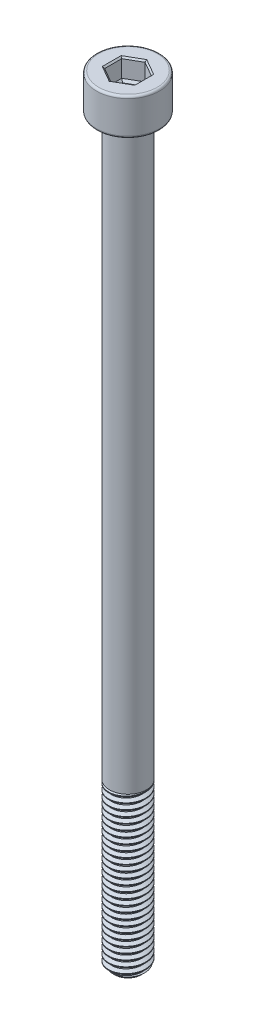
from build123d import *

# Parameters (mm, degrees)
SKETCH1_R           = 2.5
BOSS_EXTRUDE1_DEPTH = 22
THREAD1_PITCH       = 0.8
SKETCH2_R           = 2.5
BOSS_EXTRUDE2_DEPTH = 78
SKETCH3_R           = 4.25
BOSS_EXTRUDE3_DEPTH = 5
FILLET1_R           = 0.3
CUT_EXTRUDE1_DEPTH  = 2.5
CHAMFER1_SIZE       = 0.2
CUT_EXTRUDE2_DEPTH  = 0.3
CUT_EXTRUDE2_DRAFT  = -45


with BuildPart() as part:
    # Sketch1 → Boss-Extrude1 (new body)
    with BuildSketch(Plane(origin=(0, 0, 0), x_dir=(1, 0, 0), z_dir=(0, 1, 0))):
        with Locations(Location((0, 0, 0), (0, 0, 270))):
            Circle(SKETCH1_R)
    extrude(amount=BOSS_EXTRUDE1_DEPTH)

    # Thread1: arcs per turn and ends read off the stored shape
    # Thread1: the profile of Thread Profile1 profile screwed along a right-hand helix through 30 turns, 8 arcs to a turn; built about Z, then put on its axis
    thread1_z = Axis((0, 0, 0), (0, 0, 1))
    thread1_corners = [(2.5003, 0, -0.000173205), (2.5003, 0, 0.700173203), (2.0669873, 0, 0.449999999), (2.0669873, 0, 0.249999999)]
    with BuildLine(mode=Mode.PRIVATE) as thread1_profile:
        Line(thread1_corners[0], thread1_corners[1])
        Line(thread1_corners[1], thread1_corners[2])
        Line(thread1_corners[2], thread1_corners[3])
        Line(thread1_corners[3], thread1_corners[0])
    thread1_cap = Face(thread1_profile.wire())
    thread1_turn_angles = [0, 22.5, 45, 67.5, 90, 112.5, 135, 157.5, 180, 202.5, 225, 247.5, 270, 292.5, 315, 337.5, 360]
    thread1_turn_weights = [1, 0.9238795325112867, 1, 0.9238795325112867, 1, 0.9238795325112867, 1, 0.9238795325112867, 1, 0.9238795325112867, 1, 0.9238795325112867, 1, 0.9238795325112867, 1, 0.9238795325112867, 1]
    thread1_turn_rails = [Edge.make_bspline([Vector(p[0], p[1], 0).rotate(thread1_z, thread1_turn_angles[k]) / thread1_turn_weights[k] + Vector(0, 0, p[2] + THREAD1_PITCH * thread1_turn_angles[k] / 360) for k in range(17)], [0, 0, 0, 1, 1, 2, 2, 3, 3, 4, 4, 5, 5, 6, 6, 7, 7, 8, 8, 8], 2, thread1_turn_weights) for p in thread1_corners]
    thread1_turn_sides = [Face.make_surface_from_curves(thread1_turn_rails[p[0]], thread1_turn_rails[p[1]]) for p in [(0, 1), (1, 2), (2, 3), (3, 0)]]
    thread1 = Plane(origin=(0, 23, 0), x_dir=(-1, 0, 0), z_dir=(0, -1, 0)) * Solid(Shell([*[p.moved(Location((0, 0, THREAD1_PITCH * i))) for i in range(30) for p in thread1_turn_sides], thread1_cap, thread1_cap.rotate(thread1_z, 10800).moved(Location((0, 0, THREAD1_PITCH * 10800 / 360)))]))
    add(thread1, mode=Mode.SUBTRACT)

    # Sketch2 → Boss-Extrude2 (add)
    with BuildSketch(Plane(origin=(0, 22, 0), x_dir=(1, 0, 0), z_dir=(0, 1, 0))):
        with Locations(Location((0, 0, 0), (0, 0, 90))):
            Circle(SKETCH2_R)
    extrude(amount=BOSS_EXTRUDE2_DEPTH)

    # Sketch3 → Boss-Extrude3 (add)
    with BuildSketch(Plane(origin=(0, 100, 0), x_dir=(1, 0, 0), z_dir=(0, 1, 0))):
        with Locations(Location((0, 0, 0), (0, 0, 270))):
            Circle(SKETCH3_R)
    extrude(amount=BOSS_EXTRUDE3_DEPTH)

    # Fillet1
    fillet1_edges = [part.edges().sort_by_distance(p)[0] for p in [
        (0, 100, -4.25),
        (0, 105, -4.25),
    ]]
    fillet(fillet1_edges, radius=FILLET1_R)

    # Sketch4 → Cut-Revolve1 (revolve, cut)
    with BuildSketch(Plane.XY, mode=Mode.PRIVATE) as cut_revolve1_sk:
        Polygon((2.51, 0), (2.51, 0.7), (1.81, 0), align=None)
    revolve(cut_revolve1_sk.sketch.rotate(Axis((0, 0, 0), (0, 1, 0)), 90), axis=Axis((0, 0, 0), (0, 1, 0)), mode=Mode.SUBTRACT)

    # Sketch5 → Cut-Extrude1 (cut)
    with BuildSketch(Plane(origin=(0, 105, 0), x_dir=(1, 0, 0), z_dir=(0, 1, 0))):
        Polygon((0, 2.309401077), (-2, 1.154700538), (-2, -1.154700538), (0, -2.309401077), (2, -1.154700538), (2, 1.154700538), align=None)
    extrude(amount=-CUT_EXTRUDE1_DEPTH, mode=Mode.SUBTRACT)

    # Chamfer1
    chamfer1_edges = [part.edges().sort_by_distance(p)[0] for p in [
        (1, 105, -1.732050808),
        (-1, 105, -1.732050808),
        (-2, 105, 0),
        (-1, 105, 1.732050808),
        (1, 105, 1.732050808),
        (2, 105, 0),
    ]]
    chamfer(chamfer1_edges, length=CHAMFER1_SIZE)


with BuildPart() as cut_extrude2_tool:
    # Sketch6 → Cut-Extrude2 (with draft: the straight prism first)
    with BuildSketch(Plane(origin=(0, 102.5, 0), x_dir=(1, 0, 0), z_dir=(0, 1, 0))):
        Polygon((0, 2.309401077), (-2, 1.154700538), (-2, -1.154700538), (0, -2.309401077), (2, -1.154700538), (2, 1.154700538), align=None)
    extrude(amount=-CUT_EXTRUDE2_DEPTH)
    # Cut-Extrude2: the draft: its side faces are tilted about the plane it starts from
    cut_extrude2_sides = [cut_extrude2_tool.faces().sort_by_distance(p)[0] for p in [
        (-1, 102.35, -1.732050808),
        (-2, 102.35, 0),
        (-1, 102.35, 1.732050808),
        (1, 102.35, 1.732050808),
        (2, 102.35, 0),
        (1, 102.35, -1.732050808),
    ]]
    draft(cut_extrude2_sides, Plane(origin=(0, 102.5, 0), x_dir=(1, 0, 0), z_dir=(0, 1, 0)), CUT_EXTRUDE2_DRAFT)


with BuildPart() as part_1:
    add(part.part)

    # Cut-Extrude2: cut by cut_extrude2_tool
    add(cut_extrude2_tool.part, mode=Mode.SUBTRACT)


solid = part_1.part
